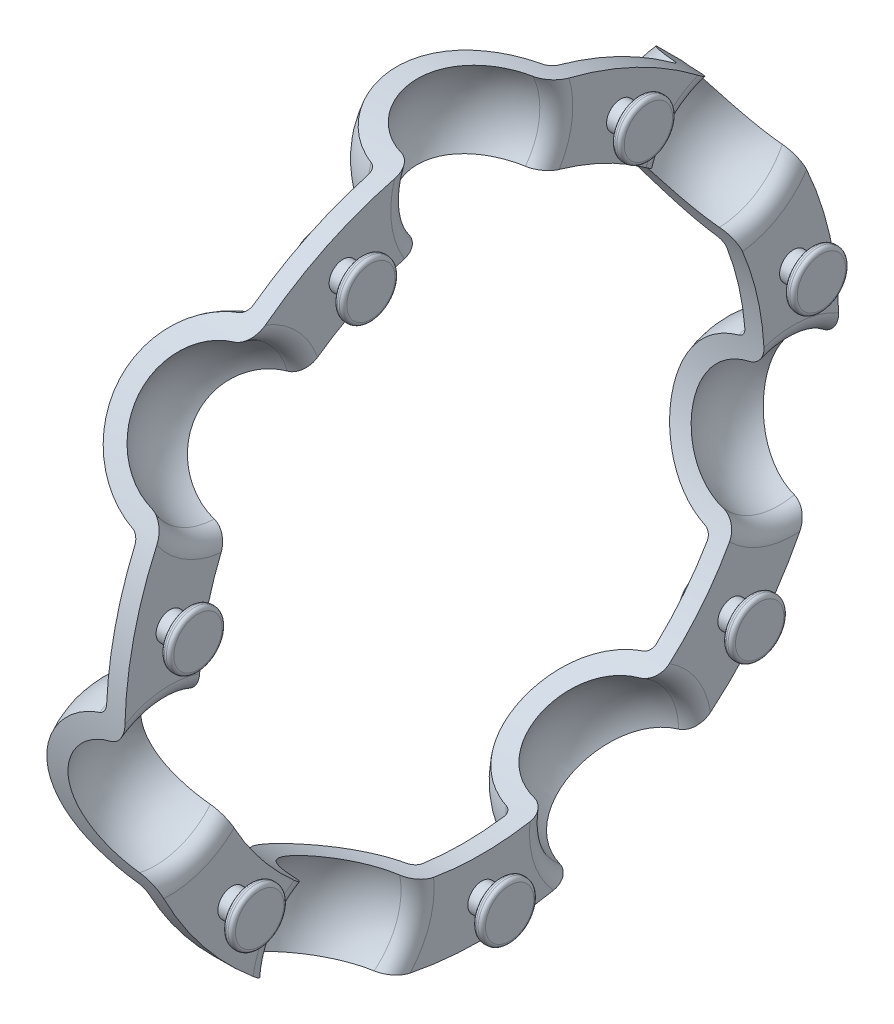
from build123d import *

# Parameters (mm, degrees)
SKETCH1_R                = 23
BOSS_EXTRUDE1_DEPTH      = 1
REVOLVE1_ANGLE           = 180.0000000000004
CUT_REVOLVE1_ANGLE       = 180.0000000000004
FILLET1_R                = 1
FILLET2_R                = 0.5
CIRPATTERN1_COUNT        = 7
FILLET1_OF_CIRPATTERN1_R = 1
FILLET2_OF_CIRPATTERN1_R = 0.5
SKETCH4_R                = 23
SKETCH4_R_2              = 19.200000000000003
CUT_EXTRUDE1_DEPTH       = 33.908965483588204
SKETCH5_R                = 15.200000000000001
CUT_EXTRUDE2_DEPTH       = 28.609418822008806
SKETCH6_R                = 0.7500000000000002
CUT_EXTRUDE3_DEPTH       = 1.5
CIRPATTERN2_COUNT        = 7
CIRPATTERN5_COUNT        = 7


with BuildPart() as part:
    # Sketch1 → Boss-Extrude1 (new body)
    with BuildSketch(Plane(origin=(0, 0, 0), x_dir=(0, 0, -1), z_dir=(1, 0, 0))):
        Circle(SKETCH1_R)
    extrude(amount=BOSS_EXTRUDE1_DEPTH)

    # Sketch2 → Revolve1 (revolve)
    with BuildSketch(Plane(origin=(1, 0, 0), x_dir=(0, 0, -1), z_dir=(1, 0, 0))):
        with BuildLine():
            Line((-5, 17.2), (5, 17.2))
            ThreePointArc((5, 17.2), (-9.2e-16, 12.2), (-5, 17.2))
        make_face()
    revolve1 = revolve(axis=Axis((1, 17.2, 5), (0, 0, -1)), revolution_arc=REVOLVE1_ANGLE)

    # Sketch3 → Cut-Revolve1 (revolve, cut)
    with BuildSketch(Plane(origin=(1, 0, 0), x_dir=(0, 0, -1), z_dir=(1, 0, 0))):
        with BuildLine():
            Line((-4, 17.2), (4, 17.2))
            ThreePointArc((4, 17.2), (-5.1e-16, 13.2), (-4, 17.2))
        make_face()
    cut_revolve1 = revolve(axis=Axis((1, 17.2, 4), (0, 0, -1)), revolution_arc=CUT_REVOLVE1_ANGLE, mode=Mode.SUBTRACT)

    # Fillet1
    fillet1_edges = [part.edges().sort_by_distance(p)[0] for p in [
        (1.0000000000000278, 21.2, -1.3e-16),
    ]]
    fillet(fillet1_edges, radius=FILLET1_R)

    # Fillet2
    fillet2_edges = [part.edges().sort_by_distance(p)[0] for p in [
        (0, 17.2, -4.898979485566356),
    ]]
    fillet(fillet2_edges, radius=FILLET2_R)

    # CirPattern1: Revolve1, Cut-Revolve1 ×7 about axis
    cirpattern1_axis = Axis((1, 0, 0), (1, 0, 0))
    add([revolve1.rotate(cirpattern1_axis, i * 360 / CIRPATTERN1_COUNT) for i in range(1, CIRPATTERN1_COUNT)])
    add([cut_revolve1.rotate(cirpattern1_axis, i * 360 / CIRPATTERN1_COUNT) for i in range(1, CIRPATTERN1_COUNT)], mode=Mode.SUBTRACT)

    # Fillet1 of CirPattern1
    fillet1_of_cirpattern1_edges = [part.edges().sort_by_distance(p)[0] for p in [
        (1.0000000000000278, 13.217983799405152, 16.57482742832223),
        (1.0000000000000278, -4.717443799873863, 20.66847173825466),
        (1.0000000000000278, -19.100539999531282, 9.198335269292235),
        (1.0000000000000275, -19.100539999531286, -9.19833526929223),
        (1.0000000000000278, -4.71744379987385, -20.668471738254663),
        (1.0000000000000278, 13.217983799405147, -16.574827428322234),
    ]]
    fillet(fillet1_of_cirpattern1_edges, radius=FILLET1_OF_CIRPATTERN1_R)

    # Fillet2 of CirPattern1
    fillet2_of_cirpattern1_edges = [part.edges().sort_by_distance(p)[0] for p in [
        (0, 14.554200985751027, 10.393037749684344),
        (0, 0.9487917776361852, 17.858885580088415),
        (0, -13.371076990863864, 11.876628313809896),
        (1.1e-16, -17.62225206497935, -3.0489723118341017),
        (0, -8.603511905733388, -15.678634598966322),
        (0, 6.893848198189403, -16.50196524721588),
    ]]
    fillet(fillet2_of_cirpattern1_edges, radius=FILLET2_OF_CIRPATTERN1_R)

    # Sketch4 → Cut-Extrude1 (cut, through all)
    with BuildSketch(Plane(origin=(1, 0, 0), x_dir=(0, 0, -1), z_dir=(1, 0, 0))):
        Circle(SKETCH4_R)
        Circle(SKETCH4_R_2, mode=Mode.SUBTRACT)
    extrude(amount=-CUT_EXTRUDE1_DEPTH, mode=Mode.SUBTRACT)

    # Sketch5 → Cut-Extrude2 (cut, through all)
    with BuildSketch(Plane(origin=(1, 0, 0), x_dir=(0, 0, -1), z_dir=(1, 0, 0))):
        Circle(SKETCH5_R)
    extrude(amount=-CUT_EXTRUDE2_DEPTH, mode=Mode.SUBTRACT)

    # Sketch6 → Cut-Extrude3 (cut)
    with BuildSketch(Plane(origin=(1, 0, 0), x_dir=(0, 0, -1), z_dir=(1, 0, 0))):
        with Locations((0, -17.2)):
            Circle(SKETCH6_R)
    cut_extrude3 = extrude(amount=-CUT_EXTRUDE3_DEPTH, mode=Mode.SUBTRACT)

    # CirPattern2: Cut-Extrude3 ×7 about axis
    cirpattern2_axis = Axis((1, 0, 0), (1, 0, 0))
    for i in range(1, CIRPATTERN2_COUNT):
        add(cut_extrude3.rotate(cirpattern2_axis, i * 360 / CIRPATTERN2_COUNT), mode=Mode.SUBTRACT)


with BuildPart() as body_2:
    # Sketch10 → Revolve2 (revolve)
    with BuildSketch(Plane.XY):
        with BuildLine():
            Line((2.5, -17.2), (2.5, -16.45))
            Line((2.5, -16.45), (2.5, -15.9))
            ThreePointArc((2.5, -15.9), (2.441421356237308, -15.75857864376269), (2.2999999999999985, -15.7))
            Line((2.2999999999999985, -15.7), (2.1976587318961314, -15.7))
            ThreePointArc((2.1976587318961314, -15.7), (2.0562373756588195, -15.758578643762688), (1.9976587318961299, -15.9))
            Line((1.9976587318961299, -15.9), (1.9976587318961299, -16.45))
            Line((1.9976587318961299, -16.45), (1.1e-16, -16.45))
            Line((1.1e-16, -16.45), (0, -15.899999999999997))
            ThreePointArc((0, -15.899999999999997), (-0.05857864376269048, -15.758578643762688), (-0.19999999999999998, -15.7))
            Line((-0.19999999999999998, -15.7), (-0.29999999999999993, -15.7))
            ThreePointArc((-0.29999999999999993, -15.7), (-0.44142135623730766, -15.75857864376269), (-0.4999999999999999, -15.899999999999997))
            Line((-0.4999999999999999, -15.899999999999997), (-0.4999999999999998, -17.2))
            Line((-0.4999999999999998, -17.2), (2.5, -17.2))
        make_face()
    revolve(axis=Axis((1, -17.2, 0), (1, 0, 0)))


with BuildPart() as cirpattern5_1:
    # CirPattern5: pattern copy
    add(body_2.part.rotate(Axis((1, 0, 0), (1, 0, 0)), 1 * 360 / CIRPATTERN5_COUNT))


with BuildPart() as cirpattern5_2:
    # CirPattern5: pattern copy
    add(body_2.part.rotate(Axis((1, 0, 0), (1, 0, 0)), 2 * 360 / CIRPATTERN5_COUNT))


with BuildPart() as cirpattern5_3:
    # CirPattern5: pattern copy
    add(body_2.part.rotate(Axis((1, 0, 0), (1, 0, 0)), 3 * 360 / CIRPATTERN5_COUNT))


with BuildPart() as cirpattern5_4:
    # CirPattern5: pattern copy
    add(body_2.part.rotate(Axis((1, 0, 0), (1, 0, 0)), 4 * 360 / CIRPATTERN5_COUNT))


with BuildPart() as cirpattern5_5:
    # CirPattern5: pattern copy
    add(body_2.part.rotate(Axis((1, 0, 0), (1, 0, 0)), 5 * 360 / CIRPATTERN5_COUNT))


with BuildPart() as cirpattern5_6:
    # CirPattern5: pattern copy
    add(body_2.part.rotate(Axis((1, 0, 0), (1, 0, 0)), 6 * 360 / CIRPATTERN5_COUNT))


solid = Compound([part.part, body_2.part, cirpattern5_1.part, cirpattern5_2.part, cirpattern5_3.part, cirpattern5_4.part, cirpattern5_5.part, cirpattern5_6.part])
